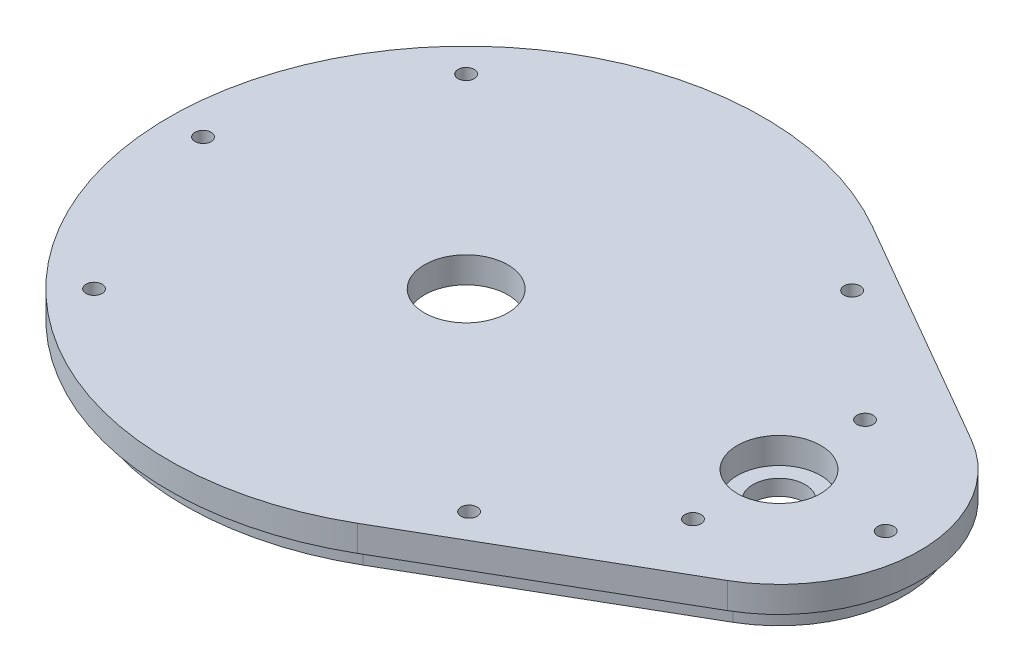
from build123d import *

# Parameters (mm, degrees)
SKETCH1_R           = 8
SKETCH1_R_2         = 1.55
BOSS_EXTRUDE1_DEPTH = 5
SKETCH2_R           = 12
SKETCH2_R_2         = 5
BOSS_EXTRUDE2_DEPTH = 3
BOSS_EXTRUDE3_DEPTH = 4
SKETCH5_R           = 1.55
CUT_EXTRUDE1_DEPTH  = 5


with BuildPart() as part:
    # Sketch1 → Boss-Extrude1 (new body)
    with BuildSketch(Plane(origin=(0, 0, 0), x_dir=(1, 0, 0), z_dir=(0, 1, 0))):
        with BuildLine():
            Line((13.5, -49.363448016), (58.5, -23.382685902))
            ThreePointArc((58.5, -23.382685902), (72, 0), (58.5, 23.382685902))
            Line((58.5, 23.382685902), (13.5, 49.363448016))
            ThreePointArc((13.5, 49.363448016), (-72, 0), (13.5, -49.363448016))
        make_face()
        with Locations((-15, 0)):
            Circle(SKETCH1_R, mode=Mode.SUBTRACT)
        with Locations((45, 0)):
            Circle(SKETCH1_R, mode=Mode.SUBTRACT)
        with Locations((45, 16.5)):
            Circle(SKETCH1_R_2, mode=Mode.SUBTRACT)
        with Locations((45, -16.5)):
            Circle(SKETCH1_R_2, mode=Mode.SUBTRACT)
    extrude(amount=BOSS_EXTRUDE1_DEPTH)

    # Sketch2 → Boss-Extrude2 (add)
    with BuildSketch(Plane.XZ):
        with Locations((45, 0)):
            Circle(SKETCH2_R)
        with Locations((45, 0)):
            Circle(SKETCH2_R_2, mode=Mode.SUBTRACT)
    extrude(amount=BOSS_EXTRUDE2_DEPTH)

    # Sketch4 → Boss-Extrude3 (add)
    with BuildSketch(Plane.XZ):
        with BuildLine():
            Line((12, 46.765371804), (57, 20.784609691))
            ThreePointArc((57, 20.784609691), (69, 0), (57, -20.784609691))
            Line((57, -20.784609691), (12, -46.765371804))
            ThreePointArc((12, -46.765371804), (-69, 0), (12, 46.765371804))
        make_face()
        with BuildLine():
            Line((11, -45.033320997), (56, -19.052558883))
            ThreePointArc((56, -19.052558883), (67, 0), (56, 19.052558883))
            Line((56, 19.052558883), (11, 45.033320997))
            ThreePointArc((11, 45.033320997), (-67, 0), (11, -45.033320997))
        make_face(mode=Mode.SUBTRACT)
    extrude(amount=BOSS_EXTRUDE3_DEPTH)

    # Sketch5 → Cut-Extrude1 (cut)
    with BuildSketch(Plane(origin=(0, 5, 0), x_dir=(1, 0, 0), z_dir=(0, 1, 0))):
        with Locations((-65.45, 0)):
            Circle(SKETCH5_R)
        with Locations((65.45, 0)):
            Circle(SKETCH5_R)
        with Locations((-50.673537111, -35.673537111)):
            Circle(SKETCH5_R)
        with Locations((-50.673537111, 35.673537111)):
            Circle(SKETCH5_R)
        with Locations((22.284740181, 36.728311109)):
            Circle(SKETCH5_R)
        with Locations((22.291641994, -36.724302618)):
            Circle(SKETCH5_R)
    extrude(amount=-CUT_EXTRUDE1_DEPTH, mode=Mode.SUBTRACT)


solid = part.part
